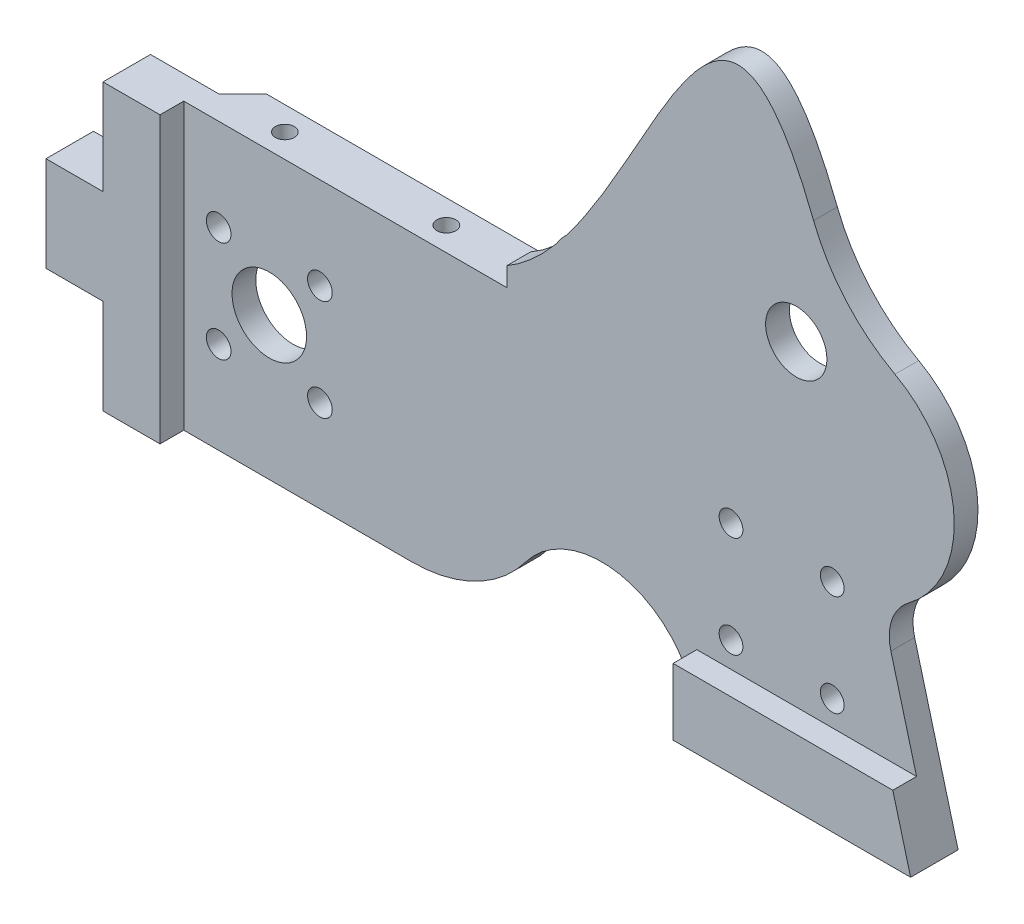
from build123d import *

# Parameters (mm, degrees)
SKETCH1_R           = 1.651
BOSS_EXTRUDE1_DEPTH = 3.175
CUT_EXTRUDE2_DEPTH  = 6.35
SKETCH7_R           = 4.9784
SKETCH7_R_2         = 1.5875
CUT_EXTRUDE3_DEPTH  = 124.96234811
FILLET1_R           = 6.35
SKETCH8_W           = 50.8
SKETCH8_H           = 12.7
CUT_EXTRUDE4_DEPTH  = 50.8
CUT_EXTRUDE5_DEPTH  = 19.304
FILLET6_R           = 6.35
FILLET7_R           = 6.35
FILLET8_R           = 19.05
BOSS_EXTRUDE2_DEPTH = 3.175
FILLET9_R           = 24.13
SKETCH13_W          = 41.667851519
SKETCH13_H          = 9.459584315
SKETCH13_W_2        = 28.967851519
SKETCH13_H_2        = 8.468235606
BOSS_EXTRUDE3_DEPTH = 3.175
BOSS_EXTRUDE4_DEPTH = 3.175
CUT_EXTRUDE9_DEPTH  = 119.214793194
SKETCH20_R          = 1.27
CUT_EXTRUDE10_DEPTH = 3.81
SKETCH21_R          = 1.27
CUT_EXTRUDE11_DEPTH = 6.35
SKETCH22_R          = 1.27
CUT_EXTRUDE12_DEPTH = 6.35
BOSS_EXTRUDE5_DEPTH = 3.175
SKETCH24_R          = 4.09575
CUT_EXTRUDE13_DEPTH = 3.175


with BuildPart() as part:
    # Sketch1 → Boss-Extrude1 (new body)
    with BuildSketch(Plane.XY):
        with BuildLine():
            Line((0, 0), (107.95, 0))
            Line((107.95, 0), (100.9362606, 26.175631792))
            Line((100.9362606, 26.175631792), (100.868755024, 26.427566033))
            ThreePointArc((100.868755024, 26.427566033), (110.348359368, 43.438223217), (95.367453293, 55.88))
            Line((95.367453293, 55.88), (0, 38.1))
            Line((0, 38.1), (0, 25.4))
            Line((0, 25.4), (-7.62, 25.4))
            Line((-7.62, 25.4), (-7.62, 12.7))
            Line((-7.62, 12.7), (0, 12.7))
            Line((0, 12.7), (0, 0))
        make_face()
        with Locations((25.817011896, 25.817011896)):
            Circle(SKETCH1_R, mode=Mode.SUBTRACT)
        with Locations((25.817011896, 12.282988104)):
            Circle(SKETCH1_R, mode=Mode.SUBTRACT)
        with Locations((12.282988104, 12.282988104)):
            Circle(SKETCH1_R, mode=Mode.SUBTRACT)
        with Locations((12.282988104, 25.817011896)):
            Circle(SKETCH1_R, mode=Mode.SUBTRACT)
    extrude(amount=BOSS_EXTRUDE1_DEPTH)

    # Sketch6 → Cut-Extrude2 (cut)
    with BuildSketch(Plane.XY.offset(3.175)):
        with BuildLine():
            Line((50.8, 0), (76.2, 0))
            ThreePointArc((76.2, 0), (63.5, 12.7), (50.8, 0))
        make_face()
    extrude(amount=-CUT_EXTRUDE2_DEPTH, mode=Mode.SUBTRACT)

    # Sketch7 → Cut-Extrude3 (cut, through all)
    with BuildSketch(Plane.XY.offset(3.175)):
        with Locations((19.05, 19.05)):
            Circle(SKETCH7_R)
        with Locations((80.766582748, 12.282988104)):
            Circle(SKETCH7_R_2)
        with Locations((94.299702748, 12.282988104)):
            Circle(SKETCH7_R_2)
        with Locations((80.766582748, 25.817011896)):
            Circle(SKETCH7_R_2)
        with Locations((94.299702748, 25.817011896)):
            Circle(SKETCH7_R_2)
    extrude(amount=-CUT_EXTRUDE3_DEPTH, mode=Mode.SUBTRACT)

    # Fillet1
    fillet1_edges = [part.edges().sort_by_distance(p)[0] for p in [
        (100.868755024, 26.427566033, 1.5875),
    ]]
    fillet(fillet1_edges, radius=FILLET1_R)

    # Sketch8 → Cut-Extrude4 (cut)
    with BuildSketch(Plane.XY.offset(3.175)):
        with Locations((25.4, 44.45)):
            Rectangle(SKETCH8_W, SKETCH8_H)
    extrude(amount=-CUT_EXTRUDE4_DEPTH, mode=Mode.SUBTRACT)

    # Sketch9 → Cut-Extrude5 (cut)
    with BuildSketch(Plane.XY.offset(3.175)):
        Polygon((50.8, 47.57098794), (50.8, 40.64), (57.15, 40.64), (57.15, 48.754861432), align=None)
    extrude(amount=-CUT_EXTRUDE5_DEPTH, mode=Mode.SUBTRACT)

    # Fillet6
    fillet6_edges = [part.edges().sort_by_distance(p)[0] for p in [
        (57.15, 40.64, 1.5875),
    ]]
    fillet(fillet6_edges, radius=FILLET6_R - 0.0001)  # a hair under: the kernel refuses the full size

    # Fillet7
    fillet7_edges = [part.edges().sort_by_distance(p)[0] for p in [
        (57.15, 48.754861432, 1.5875),
    ]]
    fillet(fillet7_edges, radius=FILLET7_R)

    # Fillet8
    fillet8_edges = [part.edges().sort_by_distance(p)[0] for p in [
        (50.8, 0, 1.5875),
    ]]
    fillet(fillet8_edges, radius=FILLET8_R)

    # Sketch12 → Boss-Extrude2 (add)
    with BuildSketch(Plane.XY.offset(3.175)):
        with BuildLine():
            Line((50.8, 40.64), (85.027112904, 40.64))
            Line((85.027112904, 40.64), (95.367453293, 55.88))
            add(Edge.make_bspline(
                [(50.8, 40.64), (70.777788932, 52.178803671), (78.594281742, 111.543427795), (95.367453293, 55.88)],
                knots=[0, 0, 0, 0, 1, 1, 1, 1], degree=3))
        make_face()
    extrude(amount=-BOSS_EXTRUDE2_DEPTH)

    # Fillet9
    fillet9_edges = [part.edges().sort_by_distance(p)[0] for p in [
        (95.367453293, 55.88, 1.5875),
    ]]
    fillet(fillet9_edges, radius=FILLET9_R)

    # Sketch13 → Boss-Extrude3 (add)
    with BuildSketch(Plane(origin=(0, 0, 0), x_dir=(-1, 0, 0), z_dir=(0, 0, -1))):
        with Locations((-29.966074241, 33.370207843)):
            Rectangle(SKETCH13_W, SKETCH13_H)
        with Locations((-23.616074241, 4.234117803)):
            Rectangle(SKETCH13_W_2, SKETCH13_H_2)
    extrude(amount=BOSS_EXTRUDE3_DEPTH)

    # Sketch18 → Boss-Extrude4 (add)
    with BuildSketch(Plane.XY.offset(3.175)):
        Polygon((0, 0), (7.62, 0), (7.62, 38.1), (0, 38.1), (0, 25.4), (-7.62, 25.4), (-7.62, 12.7), (0, 12.7), align=None)
    extrude(amount=BOSS_EXTRUDE4_DEPTH)

    # Sketch19 → Cut-Extrude9 (cut, through all)
    with BuildSketch(Plane(origin=(0, 38.1, 0), x_dir=(1, 0, 0), z_dir=(0, 1, 0))):
        Polygon((9.132148481, 0), (12.307148481, 3.175), (9.132148481, 3.175), align=None)
    extrude(amount=-CUT_EXTRUDE9_DEPTH, mode=Mode.SUBTRACT)

    # Sketch20 → Cut-Extrude10 (cut)
    with BuildSketch(Plane(origin=(18.309536053, 38.1, -53.667404751), x_dir=(0.9999106684671757, 0, -0.013366191885729645), z_dir=(0, 1, 0))):
        with Locations(Location((-1.073815344, -53.657845266, 0), (0, 0, 269.234150812))):
            Circle(SKETCH20_R)
        with Locations(Location((20.514255988, -53.946421349, 0), (0, 0, 269.234150812))):
            Circle(SKETCH20_R)
    extrude(amount=-CUT_EXTRUDE10_DEPTH, mode=Mode.SUBTRACT)

    # Sketch21 → Cut-Extrude11 (cut)
    with BuildSketch(Plane(origin=(0, -69.83828079, -53.667404751), x_dir=(0, 0.0318826428364363, 0.9994916193174229), z_dir=(-1, 0, 0))):
        with Locations(Location((59.242590915, 74.337262051, 0), (0, 0, 268.172949503))):
            Circle(SKETCH21_R)
        with Locations(Location((60.052410043, 99.724349182, 0), (0, 0, 268.172949503))):
            Circle(SKETCH21_R)
    extrude(amount=-CUT_EXTRUDE11_DEPTH, mode=Mode.SUBTRACT)

    # Sketch22 → Cut-Extrude12 (cut)
    with BuildSketch(Plane(origin=(18.309536053, 0, -53.667404751), x_dir=(0.9999106684671757, 0, -0.013366191885729645), z_dir=(0, -1, 0))):
        with Locations(Location((-5.686004931, 53.481882136, 0), (0, 0, 270.765849188))):
            Circle(SKETCH22_R)
        with Locations(Location((13.362293303, 53.736508092, 0), (0, 0, 270.765849188))):
            Circle(SKETCH22_R)
        with Locations((67.946889168, 56.879377031)):
            Circle(SKETCH22_R)
        with Locations((79.375868109, 57.032152605)):
            Circle(SKETCH22_R)
    extrude(amount=-CUT_EXTRUDE12_DEPTH, mode=Mode.SUBTRACT)

    # Sketch23 → Boss-Extrude5 (add)
    with BuildSketch(Plane.XY.offset(3.175)):
        Polygon((76.2, 0), (76.2, 8.89), (105.567931679, 8.89), (107.95, 0), align=None)
    extrude(amount=BOSS_EXTRUDE5_DEPTH)

    # Sketch24 → Cut-Extrude13 (cut)
    with BuildSketch(Plane(origin=(18.309536053, -69.83828079, 3.175), x_dir=(0.9998147472374107, 0.019247628596600598, 0), z_dir=(0, 0, 1))):
        with Locations(Location((73.496743516, 119.633445733, 0), (0, 0, 358.897124011))):
            Circle(SKETCH24_R)
    extrude(amount=-CUT_EXTRUDE13_DEPTH, mode=Mode.SUBTRACT)


solid = part.part
